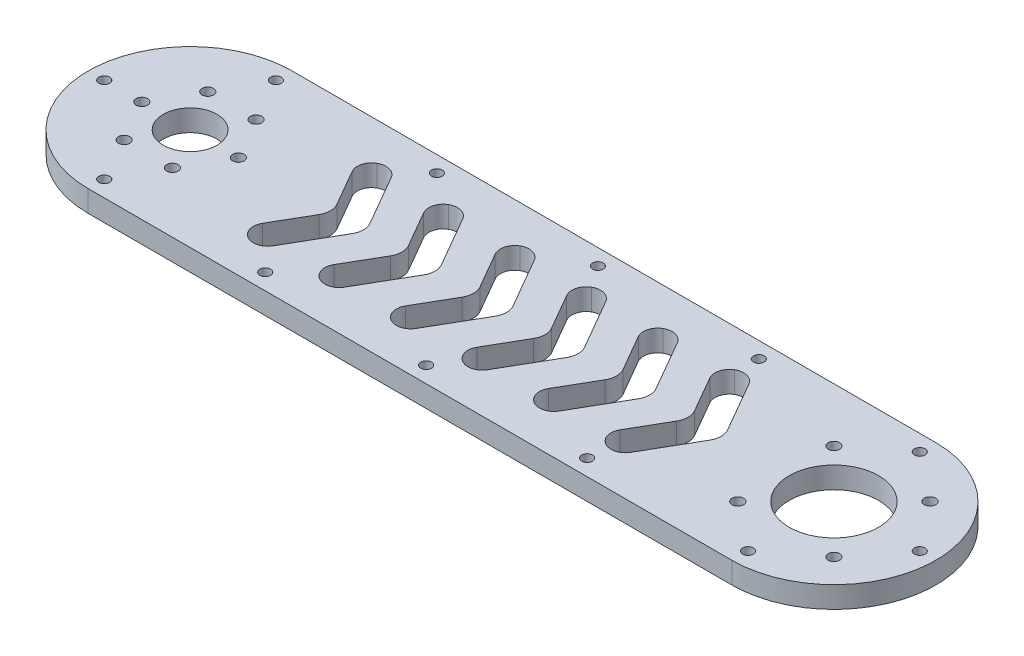
from build123d import *

# Parameters (mm, degrees)
SKETCH_1_R          = 28.5
EXTRUDE_1_DEPTH     = 6
SKETCH_3_R          = 1.6
CUT_EXTRUDE_1_DEPTH = 16
SKETCH_4_R          = 1.6
CUT_EXTRUDE_2_DEPTH = 16
CUT_EXTRUDE_3_DEPTH = 10
FILLET_2_R          = 5
FILLET_3_R          = 4
SKETCH_7_R          = 7.5
SKETCH_7_R_2        = 12.5
CUT_EXTRUDE_5_DEPTH = 10
SKETCH_6_R          = 1.5
CUT_EXTRUDE_8_DEPTH = 10


with BuildPart() as part:
    # 草图1 → 凸台-拉伸1 (new body)
    with BuildSketch(Plane(origin=(0, 0, 0), x_dir=(1, 0, 0), z_dir=(0, 1, 0))):
        Circle(SKETCH_1_R)
        with BuildLine():
            Line((180, 28.5), (0, 28.5))
            ThreePointArc((0, 28.5), (20.152543264, 20.152543264), (28.5, 0))
            ThreePointArc((28.5, 0), (20.152543264, -20.152543264), (0, -28.5))
            Line((0, -28.5), (180, -28.5))
            ThreePointArc((180, -28.5), (151.5, 0), (180, 28.5))
        make_face()
        with Locations((180, 0)):
            Circle(SKETCH_1_R)
    extrude(amount=EXTRUDE_1_DEPTH)

    # 草图3 → 切除-拉伸1 (cut)
    with BuildSketch(Plane(origin=(0, 6, 0), x_dir=(1, 0, 0), z_dir=(0, 1, 0))):
        with Locations(Location((-13.5, 0, 0), (0, 0, 270))):
            Circle(SKETCH_3_R)
        with Locations(Location((-6.75, 11.691342951, 0), (0, 0, 270))):
            Circle(SKETCH_3_R)
        with Locations(Location((6.75, 11.691342951, 0), (0, 0, 270))):
            Circle(SKETCH_3_R)
        with Locations(Location((13.5, 0, 0), (0, 0, 270))):
            Circle(SKETCH_3_R)
        with Locations(Location((6.75, -11.691342951, 0), (0, 0, 270))):
            Circle(SKETCH_3_R)
        with Locations(Location((-6.75, -11.691342951, 0), (0, 0, 270))):
            Circle(SKETCH_3_R)
    extrude(amount=-CUT_EXTRUDE_1_DEPTH, mode=Mode.SUBTRACT)

    # 草图4 → 切除-拉伸2 (cut)
    with BuildSketch(Plane(origin=(0, 6, 0), x_dir=(1, 0, 0), z_dir=(0, 1, 0))):
        with Locations(Location((193.435028843, 13.435028843, 0), (0, 0, 270))):
            Circle(SKETCH_4_R)
        with Locations(Location((193.435028843, -13.435028843, 0), (0, 0, 270))):
            Circle(SKETCH_4_R)
        with Locations(Location((166.564971157, -13.435028843, 0), (0, 0, 270))):
            Circle(SKETCH_4_R)
        with Locations(Location((166.564971157, 13.435028843, 0), (0, 0, 270))):
            Circle(SKETCH_4_R)
    extrude(amount=-CUT_EXTRUDE_2_DEPTH, mode=Mode.SUBTRACT)

    # 草图5 → 切除-拉伸3 (cut)
    with BuildSketch(Plane(origin=(0, 6, 0), x_dir=(1, 0, 0), z_dir=(0, 1, 0))):
        Polygon((40, 0), (30.762395693, 16), (37.690598923, 20), (49.237604307, 0), (37.690598923, -20), (30.762395693, -16), align=None)
        Polygon((60, 0), (50.762395693, -16), (57.690598923, -20), (69.237604307, 0), (57.690598923, 20), (50.762395693, 16), align=None)
        Polygon((80, 0), (70.762395693, -16), (77.690598923, -20), (89.237604307, 0), (77.690598923, 20), (70.762395693, 16), align=None)
        Polygon((100, 0), (90.762395693, -16), (97.690598923, -20), (109.237604307, 0), (97.690598923, 20), (90.762395693, 16), align=None)
        Polygon((120, 0), (110.762395693, -16), (117.690598923, -20), (129.237604307, 0), (117.690598923, 20), (110.762395693, 16), align=None)
        Polygon((140, 0), (130.762395693, -16), (137.690598923, -20), (149.237604307, 0), (137.690598923, 20), (130.762395693, 16), align=None)
    extrude(amount=-CUT_EXTRUDE_3_DEPTH, mode=Mode.SUBTRACT)

    # 圆角2
    fillet_2_edges = [part.edges().sort_by_distance(p)[0] for p in [
        (40, 3, 0),
        (49.237604307, 3, 0),
        (120, 3, 0),
        (129.237604307, 3, 0),
        (140, 3, 0),
        (149.237604307, 3, 0),
        (60, 3, 0),
        (69.237604307, 3, 0),
        (80, 3, 0),
        (89.237604307, 3, 0),
        (100, 3, 0),
        (109.237604307, 3, 0),
    ]]
    fillet(fillet_2_edges, radius=FILLET_2_R)

    # 圆角3
    fillet_3_edges = [part.edges().sort_by_distance(p)[0] for p in [
        (117.690598923, 3, -20),
        (97.690598923, 3, -20),
        (77.690598923, 3, -20),
        (57.690598923, 3, -20),
        (110.762395693, 3, -16),
        (90.762395693, 3, -16),
        (70.762395693, 3, -16),
        (50.762395693, 3, -16),
        (110.762395693, 3, 16),
        (90.762395693, 3, 16),
        (70.762395693, 3, 16),
        (50.762395693, 3, 16),
        (117.690598923, 3, 20),
        (97.690598923, 3, 20),
        (77.690598923, 3, 20),
        (57.690598923, 3, 20),
        (37.690598923, 3, 20),
        (30.762395693, 3, 16),
        (30.762395693, 3, -16),
        (37.690598923, 3, -20),
        (137.690598923, 3, 20),
        (130.762395693, 3, 16),
        (137.690598923, 3, -20),
        (130.762395693, 3, -16),
    ]]
    fillet(fillet_3_edges, radius=FILLET_3_R - 0.0001)  # a hair under: the kernel refuses the full size

    # 草图7 → 切除-拉伸5 (cut)
    with BuildSketch(Plane(origin=(0, 6, 0), x_dir=(1, 0, 0), z_dir=(0, 1, 0))):
        with Locations(Location((0, 0, 0), (0, 0, 270))):
            Circle(SKETCH_7_R)
        with Locations(Location((180, 0, 0), (0, 0, 270))):
            Circle(SKETCH_7_R_2)
    extrude(amount=-CUT_EXTRUDE_5_DEPTH, mode=Mode.SUBTRACT)

    # 草图6 → 切除-拉伸8 (cut)
    with BuildSketch(Plane(origin=(0, 6, 0), x_dir=(1, 0, 0), z_dir=(0, 1, 0))):
        with Locations(Location((0, 24, 0), (0, 0, 270))):
            Circle(SKETCH_6_R)
        with Locations(Location((-24, 0, 0), (0, 0, 270))):
            Circle(SKETCH_6_R)
        with Locations(Location((0, -24, 0), (0, 0, 270))):
            Circle(SKETCH_6_R)
        with Locations(Location((180, 24, 0), (0, 0, 270))):
            Circle(SKETCH_6_R)
        with Locations(Location((204, 0, 0), (0, 0, 270))):
            Circle(SKETCH_6_R)
        with Locations(Location((180, -24, 0), (0, 0, 270))):
            Circle(SKETCH_6_R)
        with Locations(Location((45, -24, 0), (0, 0, 270))):
            Circle(SKETCH_6_R)
        with Locations(Location((45, 24, 0), (0, 0, 270))):
            Circle(SKETCH_6_R)
        with Locations(Location((90, -24, 0), (0, 0, 270))):
            Circle(SKETCH_6_R)
        with Locations(Location((90, 24, 0), (0, 0, 270))):
            Circle(SKETCH_6_R)
        with Locations(Location((135, -24, 0), (0, 0, 270))):
            Circle(SKETCH_6_R)
        with Locations(Location((135, 24, 0), (0, 0, 270))):
            Circle(SKETCH_6_R)
    extrude(amount=-CUT_EXTRUDE_8_DEPTH, mode=Mode.SUBTRACT)


solid = part.part
